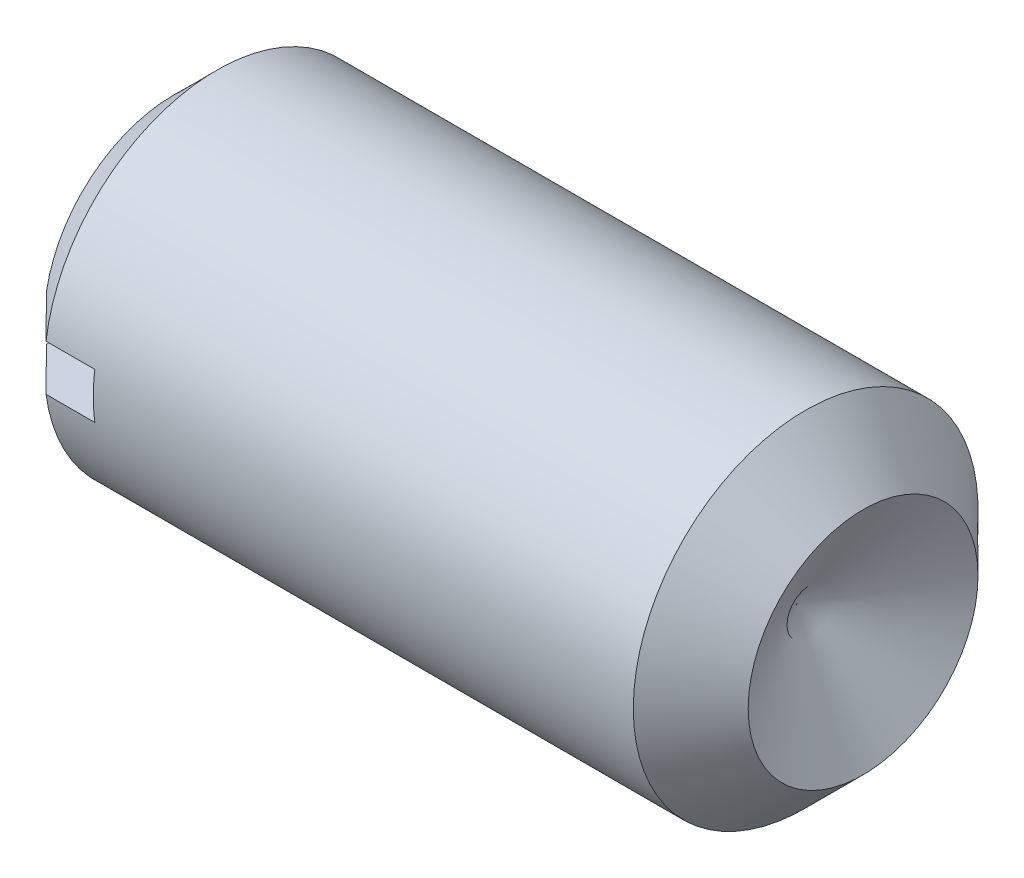
from build123d import *

# Parameters (mm, degrees)
NOTCH_DEPTH      = 7.363961031
NOTCH_DEPTH_BACK = 7.363961031
SKETCH2_W        = 0.8
SKETCH2_H        = 0.4


with BuildPart() as part:
    # Sketch1 → Base (revolve)
    with BuildSketch(Plane.XY):
        Polygon((0, 0), (5.422649731, 0), (6, 1), (5.5, 1.5), (0.375, 1.5), (0, 1.125), align=None)
    revolve(axis=Axis((-10.745014543, 0, 0), (1, 0, 0)))

    # Sketch2 → Notch (cut, two sides: drawn at the far end of the back side and taken through both)
    with BuildSketch(Plane.XY.offset(-NOTCH_DEPTH_BACK)):
        with Locations((0.4, 0)):
            Rectangle(SKETCH2_W, SKETCH2_H)
    extrude(amount=NOTCH_DEPTH + NOTCH_DEPTH_BACK, mode=Mode.SUBTRACT)


solid = part.part
